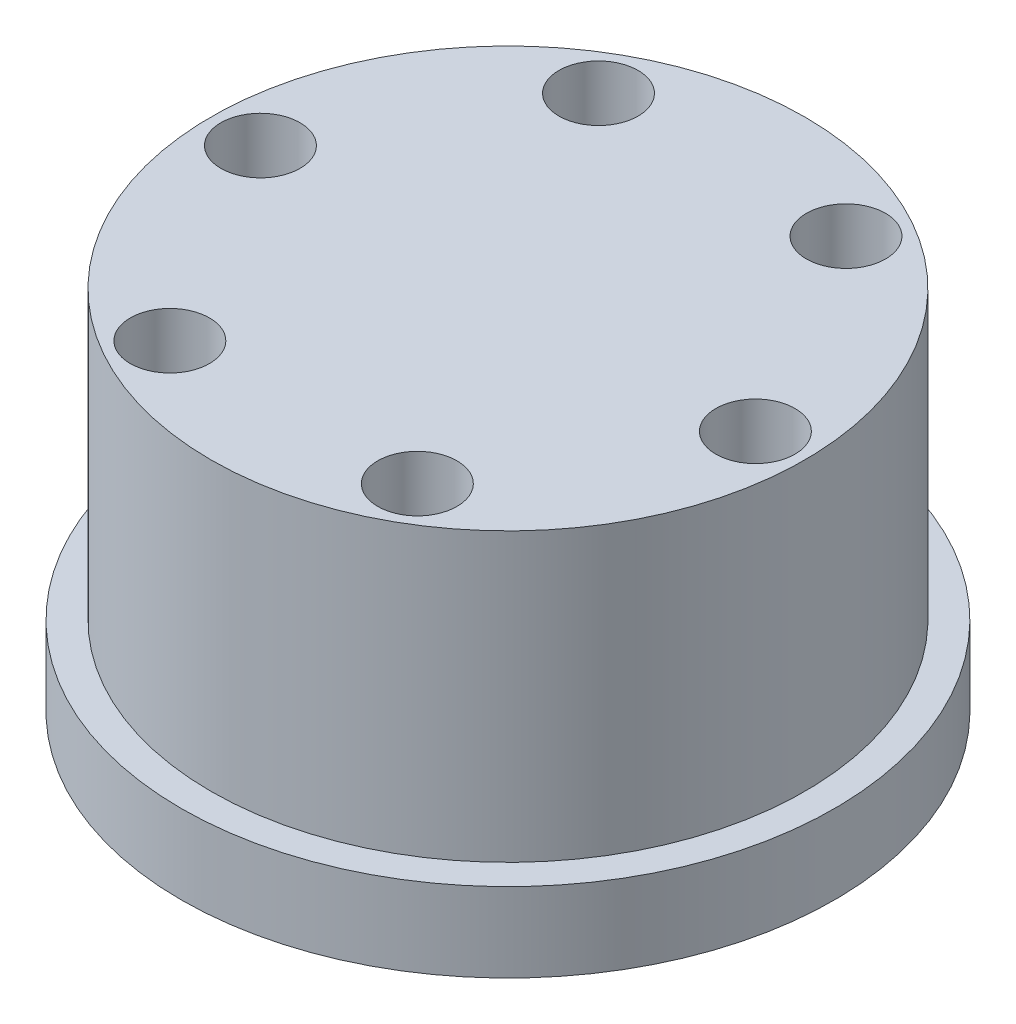
from build123d import *

# Parameters (mm, degrees)
SKETCH1_R           = 16.5
SKETCH1_R_2         = 1.5
BOSS_EXTRUDE1_DEPTH = 4
SKETCH2_R           = 15
BOSS_EXTRUDE2_DEPTH = 14.5
SKETCH3_R           = 9
CUT_EXTRUDE1_DEPTH  = 2
SKETCH4_R           = 6.5
CUT_EXTRUDE2_DEPTH  = 4
SKETCH5_R           = 2
CUT_EXTRUDE3_DEPTH  = 6.5


with BuildPart() as part:
    # Sketch1 → Boss-Extrude1 (new body)
    with BuildSketch(Plane(origin=(0, 0, 0), x_dir=(1, 0, 0), z_dir=(0, 1, 0))):
        Circle(SKETCH1_R)
        with Locations((0, 12.5)):
            Circle(SKETCH1_R_2, mode=Mode.SUBTRACT)
        with Locations((10.825317547, 6.25)):
            Circle(SKETCH1_R_2, mode=Mode.SUBTRACT)
        with Locations((10.825317547, -6.25)):
            Circle(SKETCH1_R_2, mode=Mode.SUBTRACT)
        with Locations((0, -12.5)):
            Circle(SKETCH1_R_2, mode=Mode.SUBTRACT)
        with Locations((-10.825317547, -6.25)):
            Circle(SKETCH1_R_2, mode=Mode.SUBTRACT)
        with Locations((-10.825317547, 6.25)):
            Circle(SKETCH1_R_2, mode=Mode.SUBTRACT)
    extrude(amount=BOSS_EXTRUDE1_DEPTH)

    # Sketch2 → Boss-Extrude2 (add)
    with BuildSketch(Plane(origin=(0, 4, 0), x_dir=(1, 0, 0), z_dir=(0, 1, 0))):
        Circle(SKETCH2_R)
    extrude(amount=BOSS_EXTRUDE2_DEPTH)

    # Sketch3 → Cut-Extrude1 (cut)
    with BuildSketch(Plane.XZ):
        Circle(SKETCH3_R)
    extrude(amount=-CUT_EXTRUDE1_DEPTH, mode=Mode.SUBTRACT)

    # Sketch4 → Cut-Extrude2 (cut)
    with BuildSketch(Plane.XZ.offset(-2)):
        Circle(SKETCH4_R)
    extrude(amount=-CUT_EXTRUDE2_DEPTH, mode=Mode.SUBTRACT)

    # Sketch5 → Cut-Extrude3 (cut)
    with BuildSketch(Plane(origin=(0, 18.5, 0), x_dir=(1, 0, 0), z_dir=(0, 1, 0))):
        with Locations((-12.5, 0)):
            Circle(SKETCH5_R)
        with Locations((-6.25, 10.825317547)):
            Circle(SKETCH5_R)
        with Locations((6.25, 10.825317547)):
            Circle(SKETCH5_R)
        with Locations((12.5, 0)):
            Circle(SKETCH5_R)
        with Locations((6.25, -10.825317547)):
            Circle(SKETCH5_R)
        with Locations((-6.25, -10.825317547)):
            Circle(SKETCH5_R)
    extrude(amount=-CUT_EXTRUDE3_DEPTH, mode=Mode.SUBTRACT)


solid = part.part
